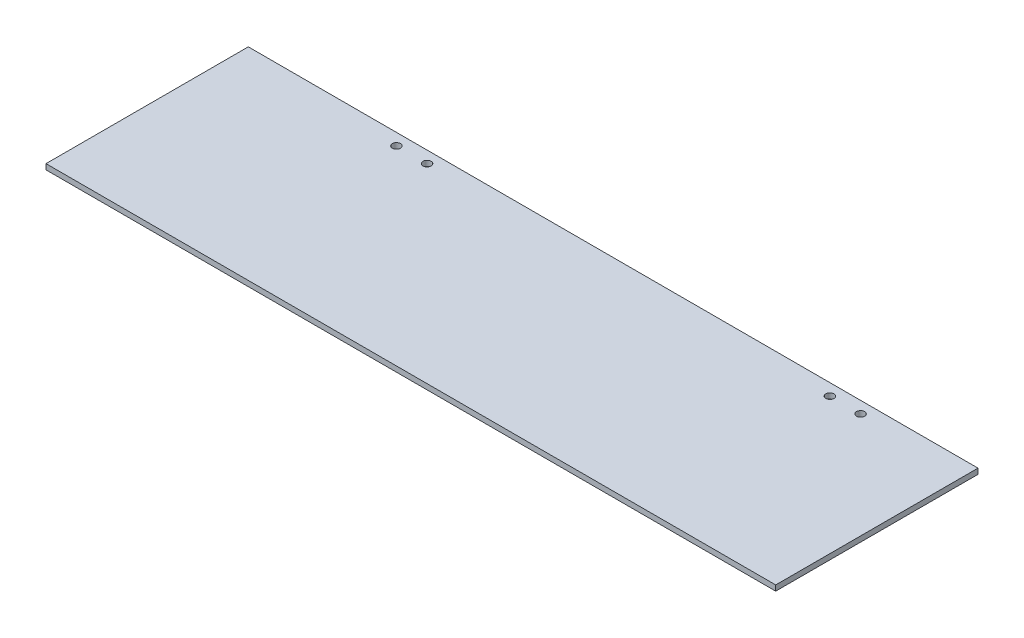
from build123d import *

# Parameters (mm, degrees)
SKETCH1_W            = 404
SKETCH1_H            = 112
BOSS_EXTRUDE1_DEPTH  = 3
M4_CLEARANCE_HOLE1_D = 4.5
LPATTERN1_COUNT      = 2
LPATTERN1_PITCH      = 240


with BuildPart() as part:
    # Sketch1 → Boss-Extrude1 (new body)
    with BuildSketch(Plane(origin=(0, 0, 0), x_dir=(1, 0, 0), z_dir=(0, 1, 0))):
        Rectangle(SKETCH1_W, SKETCH1_H)
    extrude(amount=BOSS_EXTRUDE1_DEPTH)

    # M4 Clearance Hole1 (through all)
    with Locations(Plane(origin=(0, 3, 0), x_dir=(1, 0, 0), z_dir=(0, 1, 0))):
        with Locations((126.5, 49.5), (143.5, 49.5)):
            m4_clearance_hole1 = Hole(M4_CLEARANCE_HOLE1_D / 2)

    # LPattern1: M4 Clearance Hole1 ×2
    with Locations(*[(-i * LPATTERN1_PITCH, 0, 0) for i in range(1, LPATTERN1_COUNT)]):
        add(m4_clearance_hole1, mode=Mode.SUBTRACT)


solid = part.part
